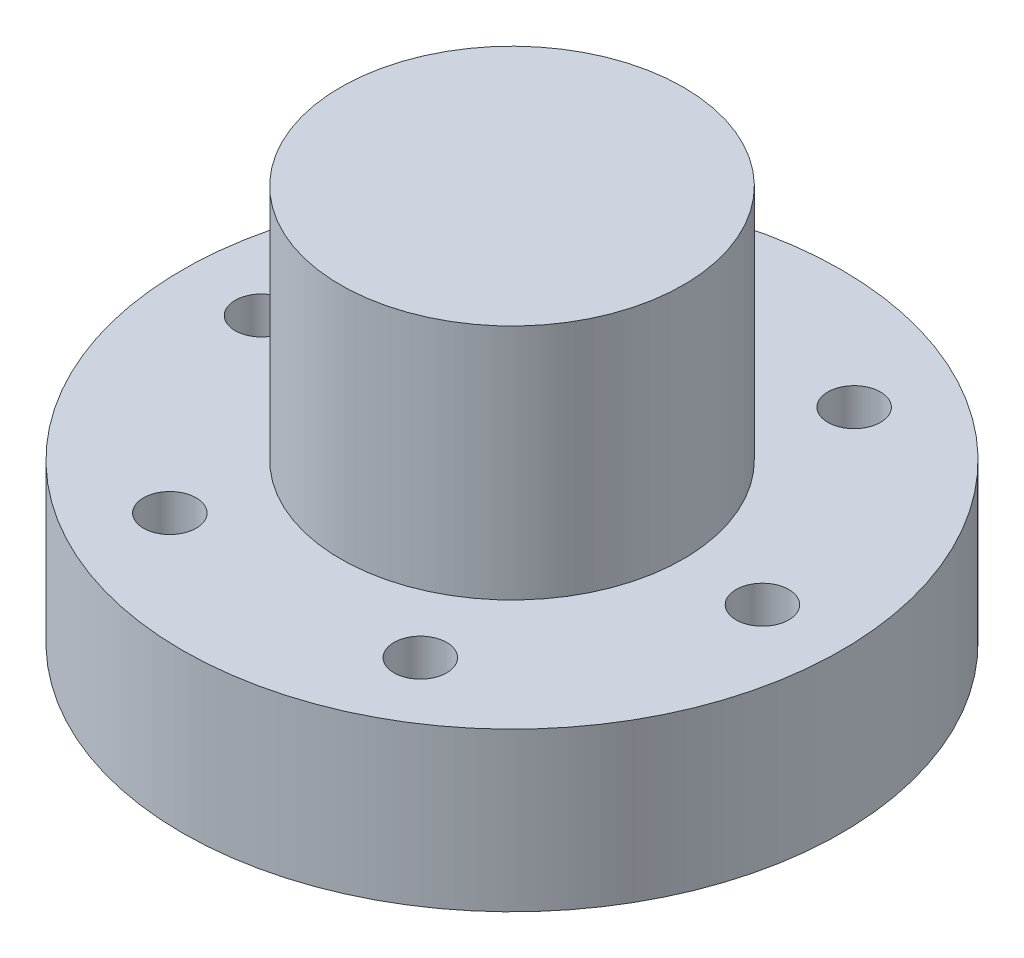
from build123d import *

# Parameters (mm, degrees)
ESQUISSE3_R             = 1
ENL_V_MAT_EXTRU_1_DEPTH = 20.836834425


with BuildPart() as part:
    # Esquisse1 → Révolution2 (revolve)
    with BuildSketch(Plane.XY):
        Polygon((6.5, 15), (6.5, 6), (12.5, 6), (12.5, 0), (0, 0), (0, 15), align=None)
    revolve(axis=Axis((0, 0, 0), (0, 1, 0)))

    # Esquisse3 → Enlèv. mat.-Extru.1 (cut, through all)
    with BuildSketch(Plane(origin=(0, 6, 0), x_dir=(1, 0, 0), z_dir=(0, 1, 0))):
        with Locations((9.5, 0)):
            Circle(ESQUISSE3_R)
        with Locations((4.75, -8.227241336)):
            Circle(ESQUISSE3_R)
        with Locations((-4.75, -8.227241336)):
            Circle(ESQUISSE3_R)
        with Locations((-9.5, 0)):
            Circle(ESQUISSE3_R)
        with Locations((-4.75, 8.227241336)):
            Circle(ESQUISSE3_R)
        with Locations((4.75, 8.227241336)):
            Circle(ESQUISSE3_R)
    extrude(amount=-ENL_V_MAT_EXTRU_1_DEPTH, mode=Mode.SUBTRACT)


solid = part.part
